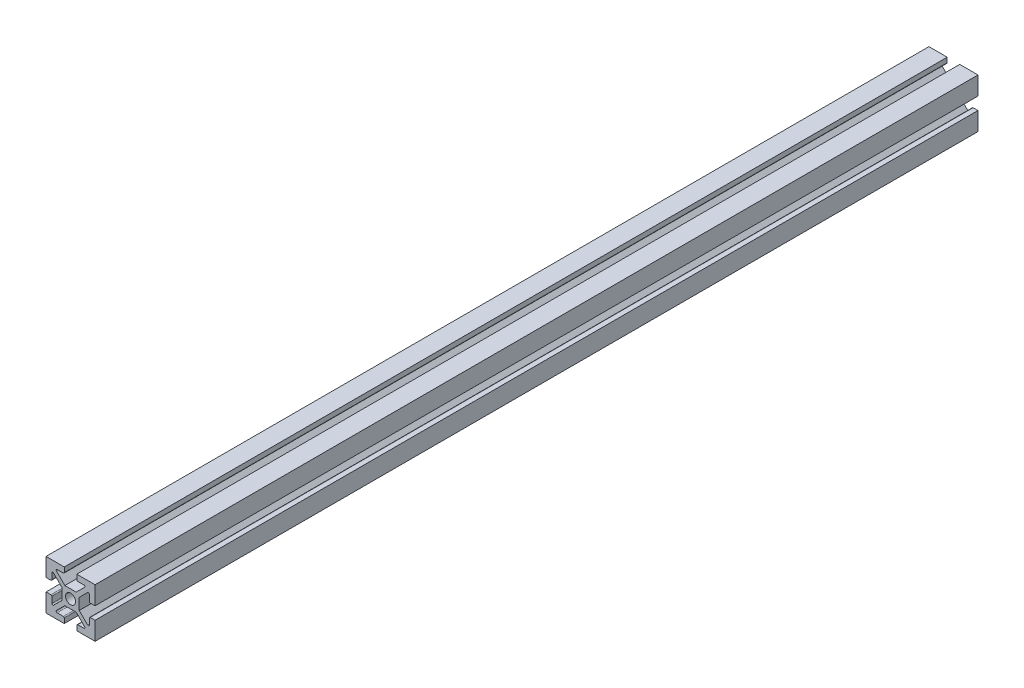
from build123d import *

# Parameters (mm, degrees)
SKETCH2_W           = 25.4
SKETCH2_H           = 25.4
BOSS_EXTRUDE2_DEPTH = 457.2
SKETCH3_R           = 2.6035
CUT_EXTRUDE2_DEPTH  = 458.55264178


with BuildPart() as part:
    # Sketch2 → Boss-Extrude2 (new body)
    with BuildSketch(Plane.XY):
        Rectangle(SKETCH2_W, SKETCH2_H)
    extrude(amount=BOSS_EXTRUDE2_DEPTH)

    # Sketch3 → Cut-Extrude2 (cut, through all)
    with BuildSketch(Plane.XY.offset(457.2)):
        Circle(SKETCH3_R)
        with BuildLine():
            Line((-3.2385, 12.7), (-3.2385, 10.218485055))
            ThreePointArc((-3.2385, 10.218485055), (-3.387289755, 9.85927481), (-3.7465, 9.710485055))
            Line((-3.7465, 9.710485055), (-6.9215, 9.710485055))
            ThreePointArc((-6.9215, 9.710485055), (-7.390830803, 9.396888238), (-7.280710245, 8.84327481))
            Line((-7.280710245, 8.84327481), (-2.945935435, 4.5085))
            Line((-2.945935435, 4.5085), (2.945935435, 4.5085))
            Line((2.945935435, 4.5085), (7.280710245, 8.84327481))
            ThreePointArc((7.280710245, 8.84327481), (7.390830803, 9.396888238), (6.9215, 9.710485055))
            Line((6.9215, 9.710485055), (3.7465, 9.710485055))
            ThreePointArc((3.7465, 9.710485055), (3.387289755, 9.85927481), (3.2385, 10.218485055))
            Line((3.2385, 10.218485055), (3.2385, 12.7))
            Line((3.2385, 12.7), (-3.2385, 12.7))
        make_face()
        with BuildLine():
            Line((12.7, 3.2385), (10.218485055, 3.2385))
            ThreePointArc((10.218485055, 3.2385), (9.85927481, 3.387289755), (9.710485055, 3.7465))
            Line((9.710485055, 3.7465), (9.710485055, 6.9215))
            ThreePointArc((9.710485055, 6.9215), (9.396888238, 7.390830803), (8.84327481, 7.280710245))
            Line((8.84327481, 7.280710245), (4.5085, 2.945935435))
            Line((4.5085, 2.945935435), (4.5085, -2.945935435))
            Line((4.5085, -2.945935435), (8.84327481, -7.280710245))
            ThreePointArc((8.84327481, -7.280710245), (9.396888238, -7.390830803), (9.710485055, -6.9215))
            Line((9.710485055, -6.9215), (9.710485055, -3.7465))
            ThreePointArc((9.710485055, -3.7465), (9.85927481, -3.387289755), (10.218485055, -3.2385))
            Line((10.218485055, -3.2385), (12.7, -3.2385))
            Line((12.7, -3.2385), (12.7, 3.2385))
        make_face()
        with BuildLine():
            Line((3.2385, -12.7), (3.2385, -10.218485055))
            ThreePointArc((3.2385, -10.218485055), (3.387289755, -9.85927481), (3.7465, -9.710485055))
            Line((3.7465, -9.710485055), (6.9215, -9.710485055))
            ThreePointArc((6.9215, -9.710485055), (7.390830803, -9.396888238), (7.280710245, -8.84327481))
            Line((7.280710245, -8.84327481), (2.945935435, -4.5085))
            Line((2.945935435, -4.5085), (-2.945935435, -4.5085))
            Line((-2.945935435, -4.5085), (-7.280710245, -8.84327481))
            ThreePointArc((-7.280710245, -8.84327481), (-7.390830803, -9.396888238), (-6.9215, -9.710485055))
            Line((-6.9215, -9.710485055), (-3.7465, -9.710485055))
            ThreePointArc((-3.7465, -9.710485055), (-3.387289755, -9.85927481), (-3.2385, -10.218485055))
            Line((-3.2385, -10.218485055), (-3.2385, -12.7))
            Line((-3.2385, -12.7), (3.2385, -12.7))
        make_face()
        with BuildLine():
            Line((-12.7, -3.2385), (-10.218485055, -3.2385))
            ThreePointArc((-10.218485055, -3.2385), (-9.85927481, -3.387289755), (-9.710485055, -3.7465))
            Line((-9.710485055, -3.7465), (-9.710485055, -6.9215))
            ThreePointArc((-9.710485055, -6.9215), (-9.396888238, -7.390830803), (-8.84327481, -7.280710245))
            Line((-8.84327481, -7.280710245), (-4.5085, -2.945935435))
            Line((-4.5085, -2.945935435), (-4.5085, 2.945935435))
            Line((-4.5085, 2.945935435), (-8.84327481, 7.280710245))
            ThreePointArc((-8.84327481, 7.280710245), (-9.396888238, 7.390830803), (-9.710485055, 6.9215))
            Line((-9.710485055, 6.9215), (-9.710485055, 3.7465))
            ThreePointArc((-9.710485055, 3.7465), (-9.85927481, 3.387289755), (-10.218485055, 3.2385))
            Line((-10.218485055, 3.2385), (-12.7, 3.2385))
            Line((-12.7, 3.2385), (-12.7, -3.2385))
        make_face()
    extrude(amount=-CUT_EXTRUDE2_DEPTH, mode=Mode.SUBTRACT)


solid = part.part
